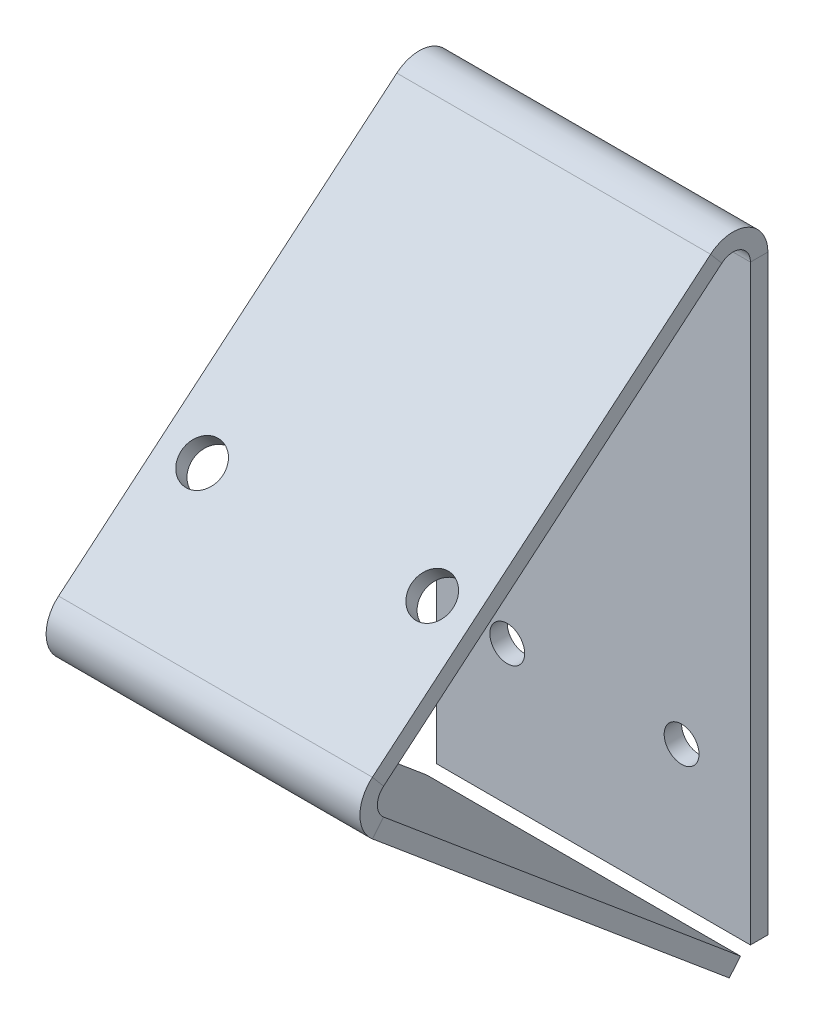
from build123d import *

# Parameters (mm, degrees)
BOSS_EXTRUDE1_START    = -63.5
BOSS_EXTRUDE1_DEPTH    = 57.15
SKETCH4_R              = 3.81
CUT_EXTRUDE2_DEPTH     = 12.7
CONVERT_SOLID3_START   = -274.103914115
CONVERT_SOLID3_DEPTH   = 57.15
CONVERT_SOLID3_2_DEPTH = 57.15
SKETCH13_R             = 3.175
CUT_EXTRUDE3_DEPTH     = 5.842


# Read off the part's stored shape, not the designer's step: Convert-Solid3
with BuildPart() as part:
    # Sketch3 → Boss-Extrude1 (new body)
    with BuildSketch(Plane.ZY.offset(337.603914115).offset(BOSS_EXTRUDE1_START)):
        Polygon((5.267071178, 203.186586599), (83.097186599, 137.879365455), (5.267071178, 72.698998764), align=None)
        Polygon((78.154944449, 137.881730876), (8.442071178, 196.377777126), (8.442071178, 79.499308876), align=None, mode=Mode.SUBTRACT)
    extrude(amount=-BOSS_EXTRUDE1_DEPTH)

    # Sketch4 → Cut-Extrude2 (cut)
    with BuildSketch(Plane(origin=(0, 121.82830981, 102.226089829), x_dir=(1, 0, 0), z_dir=(0, 0.7660444431189748, 0.6427876096865434))):
        with Locations(Location((-266.483914115, 56.721009713, 0), (0, 0, 270))):
            Circle(SKETCH4_R)
        with Locations(Location((-224.573914115, 56.721009713, 0), (0, 0, 270))):
            Circle(SKETCH4_R)
    extrude(amount=-CUT_EXTRUDE2_DEPTH, mode=Mode.SUBTRACT)

    # Convert-Solid3 outline → Convert-Solid3 (cut)
    with BuildSketch(Plane.YZ.offset(CONVERT_SOLID3_START)):
        Polygon((72.698998764, 5.267071178), (81.863084577, 5.267071178), (81.863084577, 8.442071178), (79.499308876, 8.442071178), (81.016980609, 10.254282003), (78.582837061, 12.292803573), align=None)
        with BuildLine():
            ThreePointArc((195.068228967, 8.442071178), (192.743967654, 6.117809864), (189.568967654, 5.267071178))
            Line((189.568967654, 5.267071178), (203.186586599, 5.267071178))
            Line((203.186586599, 5.267071178), (194.433349867, 15.6987725))
            ThreePointArc((194.433349867, 15.6987725), (195.822496885, 12.719737106), (195.536015795, 9.445243268))
            Line((195.536015795, 9.445243268), (196.377777126, 8.442071178))
            Line((196.377777126, 8.442071178), (195.068228967, 8.442071178))
        make_face()
        with BuildLine():
            Line((137.879365455, 83.097186599), (133.015809203, 77.289745437))
            ThreePointArc((133.015809203, 77.289745437), (137.881057106, 79.562701571), (142.748478512, 77.29440362))
            Line((142.748478512, 77.29440362), (137.879365455, 83.097186599))
        make_face()
    extrude(amount=CONVERT_SOLID3_DEPTH, mode=Mode.SUBTRACT)

    # Convert-Solid3 2 outline → Convert-Solid3 2 (add)
    with BuildSketch(Plane.YZ.offset(CONVERT_SOLID3_START)):
        with BuildLine():
            ThreePointArc((192.001158761, 13.657921839), (192.446494877, 10.275258197), (189.568967654, 8.442071178))
            Line((189.568967654, 8.442071178), (195.068228967, 8.442071178))
            ThreePointArc((195.068228967, 8.442071178), (195.324022101, 8.933445216), (195.536015795, 9.445243268))
            Line((195.536015795, 9.445243268), (192.001158761, 13.657921839))
        make_face()
        with BuildLine():
            ThreePointArc((135.44995275, 75.251223868), (137.882576702, 76.387701935), (140.316287405, 75.253552959))
            Line((140.316287405, 75.253552959), (137.881730876, 78.154944449))
            Line((137.881730876, 78.154944449), (135.44995275, 75.251223868))
        make_face()
    extrude(amount=CONVERT_SOLID3_2_DEPTH)

    # Sketch13 → Cut-Extrude3 (cut)
    with BuildSketch(Plane(origin=(0, 0, 5.267071178), x_dir=(-1, 0, 0), z_dir=(0, 0, -1))):
        with Locations((229.4949236, 107.263084577)):
            Circle(SKETCH13_R)
        with Locations((261.2449236, 107.263084577)):
            Circle(SKETCH13_R)
        with Locations((245.3699236, 151.713084577)):
            Circle(SKETCH13_R)
    extrude(amount=-CUT_EXTRUDE3_DEPTH, mode=Mode.SUBTRACT)


solid = part.part
